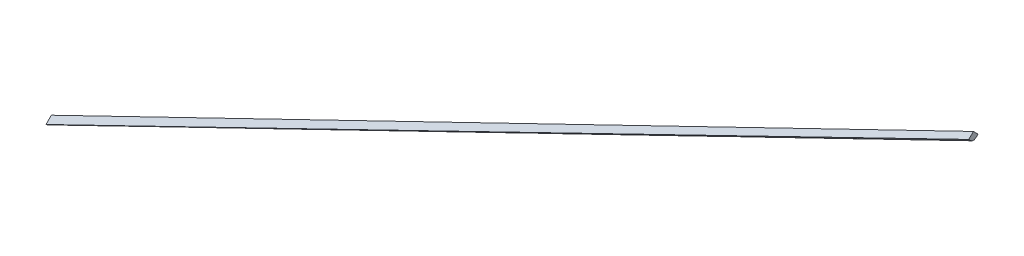
from build123d import *


with BuildPart() as part:
    # 边界1: read off the stored shape, not the designer's step
    # 边界1: loft between two sections, ruled curve by curve
    other_1_from = [
        Edge.make_bspline([(0, 114.4, 0), (0, 114.4, 0.007283832), (0, 114.21163069, 0.021848837), (0, 114.080118647, 0.043628247), (0, 113.796890955, 0.079514286), (0, 113.426193351, 0.128529824), (0, 112.936855294, 0.18976694), (0, 112.346167, 0.26242899), (0, 110.280049708, 0.51019447), (0, 105.348652112, 1.036109846), (0, 98.804019609, 1.646960293), (0, 89.588748002, 2.438566234), (0, 78.598240942, 3.29258827), (0, 64.503672569, 4.213184102), (0, 49.909977833, 4.914175355), (0, 38.983481039, 5.16800985), (0, 31.937279333, 5.159629577), (0, 28.640454039, 5.115749057), (0, 25.465916509, 5.038861572), (0, 21.515311132, 4.887732663), (0, 16.244348489, 4.576144308), (0, 11.335837752, 4.063512647), (0, 7.728885363, 3.480029887), (0, 5.964698517, 3.137385513), (0, 4.417081382, 2.772564157), (0, 3.093283382, 2.373338217), (0, 1.914166214, 1.899269319), (0, 1.059544765, 1.397620101), (0, 0.512892323, 0.915140017), (0, 0.262612741, 0.629628981), (0, 0.104439841, 0.378528288), (0, 0.018787658, 0.186587242), (0, -0.00614085, 0), (0, 0.018787658, -0.186587242), (0, 0.104439841, -0.378528288), (0, 0.262612741, -0.629628981), (0, 0.512892323, -0.915140017), (0, 1.059544765, -1.397620101), (0, 1.914166214, -1.899269319), (0, 3.093283382, -2.373338217), (0, 4.417081382, -2.772564157), (0, 5.964698517, -3.137385513), (0, 7.728885363, -3.480029887), (0, 11.335837752, -4.063512647), (0, 16.244348489, -4.576144308), (0, 21.515311132, -4.887732663), (0, 25.465916509, -5.038861572), (0, 28.640454039, -5.115749057), (0, 31.937279333, -5.159629577), (0, 38.983481039, -5.16800985), (0, 49.909977833, -4.914175355), (0, 64.503672569, -4.213184102), (0, 78.598240942, -3.29258827), (0, 89.588748002, -2.438566234), (0, 98.804019609, -1.646960293), (0, 105.348652112, -1.036109846), (0, 110.280049708, -0.51019447), (0, 112.346167, -0.26242899), (0, 112.936855294, -0.18976694), (0, 113.426193351, -0.128529824), (0, 113.796890955, -0.079514286), (0, 114.080118647, -0.043628247), (0, 114.21163069, -0.021848837), (0, 114.4, -0.007283832), (0, 114.4, 0)], [0, 0, 0, 0, 0.000711186, 0.001422112, 0.002133252, 0.004251581, 0.006369198, 0.008487526, 0.011973078, 0.033316573, 0.072750533, 0.097133325, 0.153150736, 0.215572756, 0.28012949, 0.342436877, 0.357160037, 0.371419983, 0.385154319, 0.398301185, 0.422640862, 0.45355583, 0.462206438, 0.469975829, 0.476836911, 0.482800105, 0.487877314, 0.493276037, 0.495568649, 0.497302284, 0.498179926, 0.499405099, 0.5, 0.500594901, 0.501820074, 0.502697716, 0.504431351, 0.506723963, 0.512122686, 0.517199895, 0.523163089, 0.530024171, 0.537793562, 0.54644417, 0.577359138, 0.601698815, 0.614845681, 0.628580017, 0.642839963, 0.657563123, 0.71987051, 0.784427244, 0.846849264, 0.902866675, 0.927249467, 0.966683427, 0.988026922, 0.991512474, 0.993630802, 0.995748419, 0.997866748, 0.998577888, 0.999288814, 1, 1, 1, 1], 3),
    ]
    other_1_to = [
        Edge.make_bspline([(118, 114.4, 0), (118, 114.4, 0.003641916), (118, 114.305815345, 0.010924418), (118, 114.240059323, 0.021814123), (118, 114.098445477, 0.039757143), (118, 113.913096675, 0.064264912), (118, 113.668427647, 0.09488347), (118, 113.3730835, 0.131214495), (118, 112.340024854, 0.255097235), (118, 109.874326056, 0.518054923), (118, 106.602009805, 0.823480147), (118, 101.994374001, 1.219283117), (118, 96.499120471, 1.646294135), (118, 89.451836285, 2.106592051), (118, 82.154988917, 2.457087677), (118, 76.69174052, 2.584004925), (118, 73.168639667, 2.579814789), (118, 71.520227019, 2.557874528), (118, 69.932958254, 2.519430786), (118, 67.957655566, 2.443866331), (118, 65.322174244, 2.288072154), (118, 62.867918876, 2.031756324), (118, 61.064442682, 1.740014943), (118, 60.182349259, 1.568692756), (118, 59.408540691, 1.386282078), (118, 58.746641691, 1.186669108), (118, 58.157083107, 0.949634659), (118, 57.729772382, 0.698810051), (118, 57.456446161, 0.457570009), (118, 57.33130637, 0.314814491), (118, 57.252219921, 0.189264144), (118, 57.209393829, 0.093293621), (118, 57.196929575, 0), (118, 57.209393829, -0.093293621), (118, 57.252219921, -0.189264144), (118, 57.33130637, -0.314814491), (118, 57.456446161, -0.457570009), (118, 57.729772382, -0.698810051), (118, 58.157083107, -0.949634659), (118, 58.746641691, -1.186669108), (118, 59.408540691, -1.386282078), (118, 60.182349259, -1.568692756), (118, 61.064442682, -1.740014943), (118, 62.867918876, -2.031756324), (118, 65.322174244, -2.288072154), (118, 67.957655566, -2.443866331), (118, 69.932958254, -2.519430786), (118, 71.520227019, -2.557874528), (118, 73.168639667, -2.579814789), (118, 76.69174052, -2.584004925), (118, 82.154988917, -2.457087677), (118, 89.451836285, -2.106592051), (118, 96.499120471, -1.646294135), (118, 101.994374001, -1.219283117), (118, 106.602009805, -0.823480147), (118, 109.874326056, -0.518054923), (118, 112.340024854, -0.255097235), (118, 113.3730835, -0.131214495), (118, 113.668427647, -0.09488347), (118, 113.913096675, -0.064264912), (118, 114.098445477, -0.039757143), (118, 114.240059323, -0.021814123), (118, 114.305815345, -0.010924418), (118, 114.4, -0.003641916), (118, 114.4, 0)], [0, 0, 0, 0, 0.000711186, 0.001422112, 0.002133252, 0.004251581, 0.006369198, 0.008487526, 0.011973078, 0.033316573, 0.072750533, 0.097133325, 0.153150736, 0.215572756, 0.28012949, 0.342436877, 0.357160037, 0.371419983, 0.385154319, 0.398301185, 0.422640862, 0.45355583, 0.462206438, 0.469975829, 0.476836911, 0.482800105, 0.487877314, 0.493276037, 0.495568649, 0.497302284, 0.498179926, 0.499405099, 0.5, 0.500594901, 0.501820074, 0.502697716, 0.504431351, 0.506723963, 0.512122686, 0.517199895, 0.523163089, 0.530024171, 0.537793562, 0.54644417, 0.577359138, 0.601698815, 0.614845681, 0.628580017, 0.642839963, 0.657563123, 0.71987051, 0.784427244, 0.846849264, 0.902866675, 0.927249467, 0.966683427, 0.988026922, 0.991512474, 0.993630802, 0.995748419, 0.997866748, 0.998577888, 0.999288814, 1, 1, 1, 1], 3),
    ]
    other_1 = Solid(Shell([*[Face.make_surface_from_curves(other_1_from[k], other_1_to[k]) for k in range(1)], Face(Wire(other_1_from)), Face(Wire(other_1_to))]))
    add(other_1)

    # 切除-扫描1: sweep along a path in 草图6
    with BuildLine(Plane.XY) as sweep_1_path:
        Line((0, -20), (118, 37.2))
    # 草图7 → 切除-扫描1 (sweep, cut)
    with BuildSketch(Plane.ZY):
        Polygon((0, 1), (-6.102768749, -5.102768749), (-156.658167725, 128.563638696), (142.795041805, 131.589504307), (6.102768749, -5.102768749), align=None)
    sweep(path=sweep_1_path.line, mode=Mode.SUBTRACT)


solid = part.part
